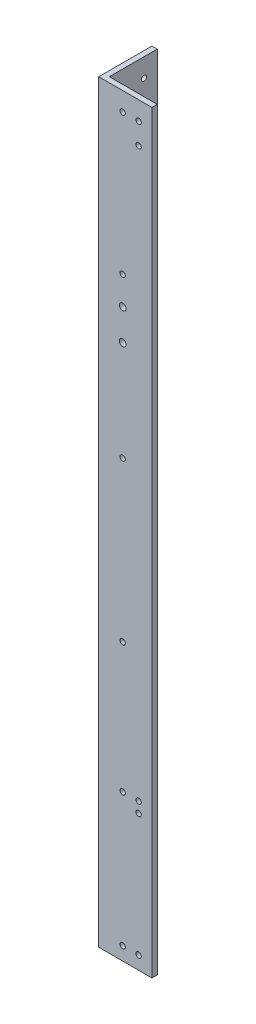
from build123d import *

# Parameters (mm, degrees)
BOSS_EXTRUDE1_DEPTH               = 450
FRONTSIDEHOLES_SKETCH3_R          = 1.5875
FRONTSIDEHOLES_SKETCH3_R_2        = 2
FRONTSIDEHOLES_CUT_EXTRUDE1_DEPTH = 3.175
LEFTSIDEHOLES_SKETCH4_R           = 1.5875
LEFTSIDEHOLES_CUT_EXTRUDE2_DEPTH  = 3.175


with BuildPart() as part:
    # Sketch2 → Boss-Extrude1 (new body)
    with BuildSketch(Plane(origin=(0, 0, 0), x_dir=(1, 0, 0), z_dir=(0, 1, 0))):
        Polygon((0, 31.75), (3.175, 31.75), (3.175, 3.175), (31.75, 3.175), (31.75, 0), (0, 0), align=None)
    extrude(amount=BOSS_EXTRUDE1_DEPTH)

    # FrontSideHoles-Sketch3 → FrontSideHoles-Cut-Extrude1 (cut)
    with BuildSketch(Plane.XY):
        with Locations((23.8125, 81.1125)):
            Circle(FRONTSIDEHOLES_SKETCH3_R)
        with Locations((14.2875, 87.4625)):
            Circle(FRONTSIDEHOLES_SKETCH3_R)
        with Locations((23.8125, 87.4625)):
            Circle(FRONTSIDEHOLES_SKETCH3_R)
        with Locations((14.2875, 438.8875)):
            Circle(FRONTSIDEHOLES_SKETCH3_R)
        with Locations((23.8125, 438.8875)):
            Circle(FRONTSIDEHOLES_SKETCH3_R)
        with Locations((23.8125, 426.1875)):
            Circle(FRONTSIDEHOLES_SKETCH3_R)
        with Locations((14.2875, 338.177644)):
            Circle(FRONTSIDEHOLES_SKETCH3_R_2)
        with Locations((14.2875, 319.652644)):
            Circle(FRONTSIDEHOLES_SKETCH3_R_2)
        with Locations((14.2875, 260)):
            Circle(FRONTSIDEHOLES_SKETCH3_R)
        with Locations((14.2875, 165)):
            Circle(FRONTSIDEHOLES_SKETCH3_R)
        with Locations((14.2875, 355)):
            Circle(FRONTSIDEHOLES_SKETCH3_R)
        with Locations((14.2875, 7.9375)):
            Circle(FRONTSIDEHOLES_SKETCH3_R)
        with Locations((23.8125, 7.9375)):
            Circle(FRONTSIDEHOLES_SKETCH3_R)
    extrude(amount=-FRONTSIDEHOLES_CUT_EXTRUDE1_DEPTH, mode=Mode.SUBTRACT)

    # LeftSideHoles-Sketch4 → LeftSideHoles-Cut-Extrude2 (cut)
    with BuildSketch(Plane.ZY):
        with Locations((-23.8125, 81.1125)):
            Circle(LEFTSIDEHOLES_SKETCH4_R)
        with Locations((-14.2875, 81.1125)):
            Circle(LEFTSIDEHOLES_SKETCH4_R)
        with Locations((-23.8125, 87.4625)):
            Circle(LEFTSIDEHOLES_SKETCH4_R)
        with Locations((-23.8125, 438.8875)):
            Circle(LEFTSIDEHOLES_SKETCH4_R)
        with Locations((-23.8125, 426.1875)):
            Circle(LEFTSIDEHOLES_SKETCH4_R)
        with Locations((-14.2875, 426.1875)):
            Circle(LEFTSIDEHOLES_SKETCH4_R)
        with Locations((-23.8125, 332.602644)):
            Circle(LEFTSIDEHOLES_SKETCH4_R)
        with Locations((-14.2875, 332.602644)):
            Circle(LEFTSIDEHOLES_SKETCH4_R)
        with Locations((-23.8125, 319.902644)):
            Circle(LEFTSIDEHOLES_SKETCH4_R)
        with Locations((-14.2875, 319.902644)):
            Circle(LEFTSIDEHOLES_SKETCH4_R)
        with Locations((-23.8125, 7.9375)):
            Circle(LEFTSIDEHOLES_SKETCH4_R)
        with Locations((-14.2875, 7.9375)):
            Circle(LEFTSIDEHOLES_SKETCH4_R)
        with Locations((-14.2875, 165)):
            Circle(LEFTSIDEHOLES_SKETCH4_R)
        with Locations((-14.2875, 260)):
            Circle(LEFTSIDEHOLES_SKETCH4_R)
        with Locations((-14.2875, 355)):
            Circle(LEFTSIDEHOLES_SKETCH4_R)
    extrude(amount=-LEFTSIDEHOLES_CUT_EXTRUDE2_DEPTH, mode=Mode.SUBTRACT)


solid = part.part
